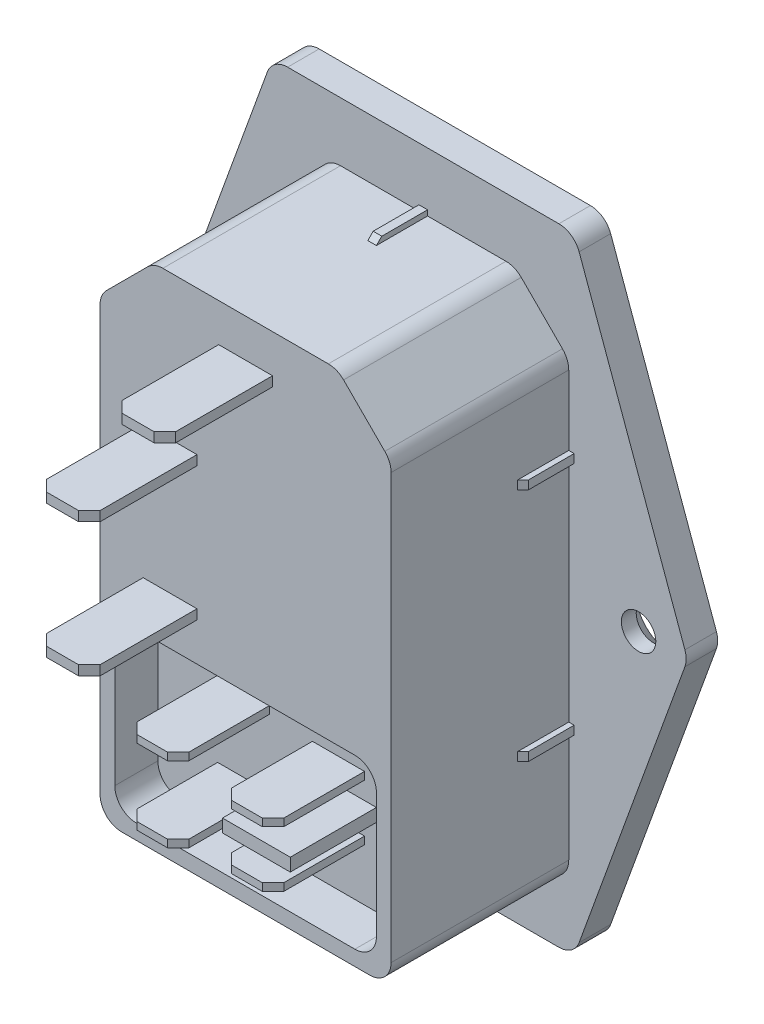
from build123d import *

# Parameters (mm, degrees)
BOSS_EXTRUDE1_START                               = -19.6
BOSS_EXTRUDE1_DEPTH                               = 10
SKETCH2_W                                         = 0.7
SKETCH2_H                                         = 10
BOSS_EXTRUDE2_DEPTH                               = 2
SKETCH3_W                                         = 17
SKETCH3_H                                         = 0.7
BOSS_EXTRUDE3_DEPTH                               = 2
SKETCH4_W                                         = 17
SKETCH4_H                                         = 0.7
BOSS_EXTRUDE4_DEPTH                               = 2
SKETCH5_W                                         = 0.7
SKETCH5_H                                         = 14
BOSS_EXTRUDE5_DEPTH                               = 2
SKETCH6_W                                         = 0.05
SKETCH6_H                                         = 14.2
BOSS_EXTRUDE6_DEPTH                               = 19.1
SKETCH7_W                                         = 0.75
SKETCH7_H                                         = 14.2
BOSS_EXTRUDE7_DEPTH                               = 4.475
SKETCH8_W                                         = 23.575
SKETCH8_H                                         = 0.75
BOSS_EXTRUDE8_DEPTH                               = 34.725
SKETCH9_W                                         = 23.575
SKETCH9_H                                         = 0.75
BOSS_EXTRUDE9_DEPTH                               = 5.525
BOSS_EXTRUDE10_DEPTH                              = 0.1
SKETCH11_W                                        = 0.75
SKETCH11_H                                        = 54.45
BOSS_EXTRUDE11_DEPTH                              = 4.475
BOSS_EXTRUDE12_DEPTH                              = 2.93
BOSS_EXTRUDE13_DEPTH                              = 16.5
CUT_EXTRUDE1_DEPTH                                = 19
BOSS_EXTRUDE14_DEPTH                              = 0.7
SKETCH16_W                                        = 2
SKETCH16_H                                        = 4
BOSS_EXTRUDE15_DEPTH                              = 19
SKETCH17_W                                        = 2
SKETCH17_H                                        = 4
BOSS_EXTRUDE16_DEPTH                              = 19
SKETCH18_W                                        = 2
SKETCH18_H                                        = 4
BOSS_EXTRUDE17_DEPTH                              = 19
SKETCH19_W                                        = 24.3
SKETCH19_H                                        = 15.6
CUT_EXTRUDE2_DEPTH                                = 4
SKETCH20_W                                        = 4.84
SKETCH20_H                                        = 0.7
BOSS_EXTRUDE18_DEPTH                              = 8.5
SKETCH21_W                                        = 4.84
SKETCH21_H                                        = 0.7
BOSS_EXTRUDE19_DEPTH                              = 8.5
SKETCH22_W                                        = 6.3
SKETCH22_H                                        = 1.2
BOSS_EXTRUDE20_DEPTH                              = 8
SKETCH23_W                                        = 4.84
SKETCH23_H                                        = 0.7
BOSS_EXTRUDE21_DEPTH                              = 8.5
SKETCH24_W                                        = 4.84
SKETCH24_H                                        = 0.7
BOSS_EXTRUDE22_DEPTH                              = 8.5
SKETCH25_W                                        = 5
SKETCH25_H                                        = 0.9
BOSS_EXTRUDE23_DEPTH                              = 10
SKETCH26_W                                        = 5
SKETCH26_H                                        = 0.9
BOSS_EXTRUDE24_DEPTH                              = 10
SKETCH27_W                                        = 5
SKETCH27_H                                        = 0.9
BOSS_EXTRUDE25_DEPTH                              = 10
CSK_FOR_4_FLAT_HEAD_MACHINE_SCREW_100_D           = 3.2
CSK_FOR_4_FLAT_HEAD_MACHINE_SCREW_100_DEPTH       = 29.43
CSK_FOR_4_FLAT_HEAD_MACHINE_SCREW_100_CSINK_D     = 6.3
CSK_FOR_4_FLAT_HEAD_MACHINE_SCREW_100_CSINK_ANGLE = 90
RIB1_START                                        = -0.4
RIB1_DEPTH                                        = 0.8
RIB2_START                                        = -0.4
RIB2_DEPTH                                        = 0.8
RIB3_START                                        = -0.4
RIB3_DEPTH                                        = 0.8
RIB4_START                                        = -0.4
RIB4_DEPTH                                        = 0.8
RIB5_START                                        = -0.4
RIB5_DEPTH                                        = 0.8
RIB6_START                                        = -0.4
RIB6_DEPTH                                        = 0.8
CHAMFER1_SIZE                                     = 1
FILLET1_R                                         = 2


with BuildPart() as part:
    # Boss-Extrude1: read off the stored shape, not the designer's step
    # Boss-Extrude1 outline → Boss-Extrude1 (new body)
    with BuildSketch(Plane(origin=(0, 0, 0), x_dir=(1, 0, 0), z_dir=(0, 1, 0)).offset(BOSS_EXTRUDE1_START)):
        with BuildLine():
            Line((7.5, 2.98), (7.5, 3.68))
            add(Edge.make_bspline(
                [(7.5, 3.68), (7.201483498, 6.178633686), (5.307474854, 7.88)],
                knots=[0, 0, 0, 1, 1, 1], degree=2))
            add(Edge.make_bspline(
                [(-7.5, 3.68), (-3.104050378, 4.272071835), (1.728784868, 4.980414582), (5.307474854, 7.88)],
                knots=[0, 0, 0, 0, 1, 1, 1, 1], degree=3))
            Line((-7.5, 3.68), (-7.5, 2.98))
            Line((-7.5, 2.98), (7.5, 2.98))
        make_face()
    extrude(amount=BOSS_EXTRUDE1_DEPTH)

    # Sketch2 → Boss-Extrude2 (add)
    with BuildSketch(Plane(origin=(7.5, 0, 0), x_dir=(0, 0, -1), z_dir=(1, 0, 0))):
        with Locations((3.33, -14.6)):
            Rectangle(SKETCH2_W, SKETCH2_H)
    extrude(amount=BOSS_EXTRUDE2_DEPTH)

    # Sketch3 → Boss-Extrude3 (add)
    with BuildSketch(Plane.XZ.offset(19.6)):
        with Locations((1, -3.33)):
            Rectangle(SKETCH3_W, SKETCH3_H)
    extrude(amount=BOSS_EXTRUDE3_DEPTH)

    # Sketch4 → Boss-Extrude4 (add)
    with BuildSketch(Plane(origin=(0, -9.6, 0), x_dir=(-1, 0, 0), z_dir=(0, 1, 0))):
        with Locations((-1, -3.33)):
            Rectangle(SKETCH4_W, SKETCH4_H)
    extrude(amount=BOSS_EXTRUDE4_DEPTH)

    # Sketch5 → Boss-Extrude5 (add)
    with BuildSketch(Plane.ZY.offset(7.5)):
        with Locations((-3.33, -14.6)):
            Rectangle(SKETCH5_W, SKETCH5_H)
    extrude(amount=BOSS_EXTRUDE5_DEPTH)

    # Sketch6 → Boss-Extrude6 (add)
    with BuildSketch(Plane(origin=(9.5, 0, 0), x_dir=(0, 0, -1), z_dir=(1, 0, 0))):
        with Locations((2.955, -14.6)):
            Rectangle(SKETCH6_W, SKETCH6_H)
    extrude(amount=-BOSS_EXTRUDE6_DEPTH)

    # Sketch7 → Boss-Extrude7 (add)
    with BuildSketch(Plane.ZY.offset(9.6)):
        with Locations((-3.305, -14.6)):
            Rectangle(SKETCH7_W, SKETCH7_H)
    extrude(amount=BOSS_EXTRUDE7_DEPTH)

    # Sketch8 → Boss-Extrude8 (add)
    with BuildSketch(Plane(origin=(0, -7.5, 0), x_dir=(-1, 0, 0), z_dir=(0, 1, 0))):
        with Locations((2.2875, -3.305)):
            Rectangle(SKETCH8_W, SKETCH8_H)
    extrude(amount=BOSS_EXTRUDE8_DEPTH)

    # Sketch9 → Boss-Extrude9 (add)
    with BuildSketch(Plane.XZ.offset(21.7)):
        with Locations((-2.2875, -3.305)):
            Rectangle(SKETCH9_W, SKETCH9_H)
    extrude(amount=BOSS_EXTRUDE9_DEPTH)

    # Sketch10 → Boss-Extrude10 (add)
    with BuildSketch(Plane(origin=(9.5, 0, 0), x_dir=(0, 0, -1), z_dir=(1, 0, 0))):
        Polygon((2.98, -7.5), (2.98, -21.7), (3.68, -21.7), (3.68, -27.225), (2.93, -27.225), (2.93, 27.225), (3.68, 27.225), (3.68, -7.5), align=None)
    extrude(amount=BOSS_EXTRUDE10_DEPTH)

    # Sketch11 → Boss-Extrude11 (add)
    with BuildSketch(Plane(origin=(9.6, 0, 0), x_dir=(0, 0, -1), z_dir=(1, 0, 0))):
        with Locations((3.305, 0)):
            Rectangle(SKETCH11_W, SKETCH11_H)
    extrude(amount=BOSS_EXTRUDE11_DEPTH)

    # Sketch12 → Boss-Extrude12 (add)
    with BuildSketch(Plane(origin=(0, 0, -2.93), x_dir=(-1, 0, 0), z_dir=(0, 0, -1))):
        Polygon((-14, -29.1), (14, -29.1), (24.55, 0), (14, 29.1), (-14, 29.1), (-24.55, 0), align=None)
    extrude(amount=-BOSS_EXTRUDE12_DEPTH)

    # Sketch13 → Boss-Extrude13 (add)
    with BuildSketch(Plane.XY):
        Polygon((13.515, -23.625), (-13.515, -23.625), (-13.515, 18.625), (-8.515, 23.625), (8.515, 23.625), (13.515, 18.625), align=None)
    extrude(amount=BOSS_EXTRUDE13_DEPTH)

    # Sketch14 → Cut-Extrude1 (cut)
    with BuildSketch(Plane(origin=(0, 0, -3.68), x_dir=(-1, 0, 0), z_dir=(0, 0, -1))):
        Polygon((-7.3, 22.625), (-12.3, 17.625), (-12.3, 5.905), (12.3, 5.905), (12.3, 17.625), (7.3, 22.625), align=None)
    extrude(amount=-CUT_EXTRUDE1_DEPTH, mode=Mode.SUBTRACT)

    # Sketch15 → Boss-Extrude14 (add)
    with BuildSketch(Plane(origin=(0, 0, -3.68), x_dir=(-1, 0, 0), z_dir=(0, 0, -1))):
        Polygon((-12.41, -4.895), (-12.41, 3.805), (-4.45, 3.805), (-4.45, 5.905), (4.45, 5.905), (4.45, 3.805), (12.41, 3.805), (12.41, -4.895), align=None)
    extrude(amount=BOSS_EXTRUDE14_DEPTH)

    # Sketch16 → Boss-Extrude15 (add)
    with BuildSketch(Plane(origin=(0, 0, 15.32), x_dir=(-1, 0, 0), z_dir=(0, 0, -1))):
        with Locations((-6.886124402, 10.905)):
            Rectangle(SKETCH16_W, SKETCH16_H)
    extrude(amount=BOSS_EXTRUDE15_DEPTH)

    # Sketch17 → Boss-Extrude16 (add)
    with BuildSketch(Plane(origin=(0, 0, 15.32), x_dir=(-1, 0, 0), z_dir=(0, 0, -1))):
        with Locations((6.886124402, 10.905)):
            Rectangle(SKETCH17_W, SKETCH17_H)
    extrude(amount=BOSS_EXTRUDE16_DEPTH)

    # Sketch18 → Boss-Extrude17 (add)
    with BuildSketch(Plane(origin=(0, 0, 15.32), x_dir=(-1, 0, 0), z_dir=(0, 0, -1))):
        with Locations((0, 17.625)):
            Rectangle(SKETCH18_W, SKETCH18_H)
    extrude(amount=BOSS_EXTRUDE17_DEPTH)

    # Sketch19 → Cut-Extrude2 (cut)
    with BuildSketch(Plane.XY.offset(16.5)):
        with Locations((0, -14.425)):
            Rectangle(SKETCH19_W, SKETCH19_H)
    extrude(amount=-CUT_EXTRUDE2_DEPTH, mode=Mode.SUBTRACT)

    # Sketch20 → Boss-Extrude18 (add)
    with BuildSketch(Plane.XY.offset(12.5)):
        with Locations((-4.18, -10.925)):
            Rectangle(SKETCH20_W, SKETCH20_H)
    extrude(amount=BOSS_EXTRUDE18_DEPTH)

    # Sketch21 → Boss-Extrude19 (add)
    with BuildSketch(Plane.XY.offset(12.5)):
        with Locations((4.63, -11.825)):
            Rectangle(SKETCH21_W, SKETCH21_H)
    extrude(amount=BOSS_EXTRUDE19_DEPTH)

    # Sketch22 → Boss-Extrude20 (add)
    with BuildSketch(Plane.XY.offset(12.5)):
        with Locations((5, -14.425)):
            Rectangle(SKETCH22_W, SKETCH22_H)
    extrude(amount=BOSS_EXTRUDE20_DEPTH)

    # Sketch23 → Boss-Extrude21 (add)
    with BuildSketch(Plane.XY.offset(12.5)):
        with Locations((4.63, -17.025)):
            Rectangle(SKETCH23_W, SKETCH23_H)
    extrude(amount=BOSS_EXTRUDE21_DEPTH)

    # Sketch24 → Boss-Extrude22 (add)
    with BuildSketch(Plane.XY.offset(12.5)):
        with Locations((-4.18, -17.925)):
            Rectangle(SKETCH24_W, SKETCH24_H)
    extrude(amount=BOSS_EXTRUDE22_DEPTH)

    # Sketch25 → Boss-Extrude23 (add)
    with BuildSketch(Plane.XY.offset(16.5)):
        with Locations((-7.015, 9.775)):
            Rectangle(SKETCH25_W, SKETCH25_H)
    extrude(amount=BOSS_EXTRUDE23_DEPTH)

    # Sketch26 → Boss-Extrude24 (add)
    with BuildSketch(Plane.XY.offset(16.5)):
        with Locations((0, 19.625)):
            Rectangle(SKETCH26_W, SKETCH26_H)
    extrude(amount=BOSS_EXTRUDE24_DEPTH)

    # Sketch27 → Boss-Extrude25 (add)
    with BuildSketch(Plane.XY.offset(16.5)):
        with Locations((-7.015, -2.625)):
            Rectangle(SKETCH27_W, SKETCH27_H)
    extrude(amount=BOSS_EXTRUDE25_DEPTH)

    # CSK for #4 Flat Head Machine Screw (100)1
    with Locations(Plane(origin=(0, 0, -2.93), x_dir=(-1, 0, 0), z_dir=(0, 0, -1))):
        with Locations((20, 0), (-20, 0)):
            CounterSinkHole(CSK_FOR_4_FLAT_HEAD_MACHINE_SCREW_100_D / 2, CSK_FOR_4_FLAT_HEAD_MACHINE_SCREW_100_CSINK_D / 2, depth=CSK_FOR_4_FLAT_HEAD_MACHINE_SCREW_100_DEPTH, counter_sink_angle=CSK_FOR_4_FLAT_HEAD_MACHINE_SCREW_100_CSINK_ANGLE)

    # Rib1: read off the stored shape, not the designer's step
    # Rib1 outline → Rib1 (add)
    with BuildSketch(Plane.XZ.offset(10.925).offset(RIB1_START)):
        Polygon((13.515, 0), (14.015, 0), (14.015, 4.25), (13.515, 4.75), align=None)
    extrude(amount=RIB1_DEPTH)

    # Rib2: read off the stored shape, not the designer's step
    # Rib2 outline → Rib2 (add)
    with BuildSketch(Plane.XZ.offset(-10.925).offset(RIB2_START)):
        Polygon((13.515, 0), (14.015, 0), (14.015, 4.25), (13.515, 4.75), align=None)
    extrude(amount=RIB2_DEPTH)

    # Rib3: read off the stored shape, not the designer's step
    # Rib3 outline → Rib3 (add)
    with BuildSketch(Plane(origin=(0, 0, 0), x_dir=(0, 0, -1), z_dir=(1, 0, 0)).offset(RIB3_START)):
        Polygon((0, 23.625), (0, 24.125), (-4.25, 24.125), (-4.75, 23.625), align=None)
    extrude(amount=RIB3_DEPTH)

    # Rib4: read off the stored shape, not the designer's step
    # Rib4 outline → Rib4 (add)
    with BuildSketch(Plane(origin=(0, 0, 0), x_dir=(0, -1, 0), z_dir=(-1, 0, 0)).offset(RIB4_START)):
        Polygon((23.625, 0), (24.125, 0), (24.125, 4.25), (23.625, 4.75), align=None)
    extrude(amount=RIB4_DEPTH)

    # Rib5: read off the stored shape, not the designer's step
    # Rib5 outline → Rib5 (add)
    with BuildSketch(Plane(origin=(0, 10.925, 0), x_dir=(1, 0, 0), z_dir=(0, 1, 0)).offset(RIB5_START)):
        Polygon((-13.515, 0), (-14.015, 0), (-14.015, -4.25), (-13.515, -4.75), align=None)
    extrude(amount=RIB5_DEPTH)

    # Rib6: read off the stored shape, not the designer's step
    # Rib6 outline → Rib6 (add)
    with BuildSketch(Plane(origin=(0, -10.925, 0), x_dir=(1, 0, 0), z_dir=(0, 1, 0)).offset(RIB6_START)):
        Polygon((-13.515, 0), (-14.015, 0), (-14.015, -4.25), (-13.515, -4.75), align=None)
    extrude(amount=RIB6_DEPTH)

    # Chamfer1
    chamfer1_edges = [part.edges().sort_by_distance(p)[0] for p in [
        (7.05, -17.025, 21),
        (2.21, -17.025, 21),
        (-1.76, -17.925, 21),
        (-6.6, -17.925, 21),
        (-4.515, 9.775, 26.5),
        (-9.515, 9.775, 26.5),
        (-2.5, 19.625, 26.5),
        (2.5, 19.625, 26.5),
        (-9.515, -2.625, 26.5),
        (-4.515, -2.625, 26.5),
        (6.886124402, 8.905, -3.68),
        (6.886124402, 12.905, -3.68),
        (-6.886124402, 8.905, -3.68),
        (-6.886124402, 12.905, -3.68),
        (0, 15.625, -3.68),
        (0, 19.625, -3.68),
        (-6.6, -10.925, 21),
        (-1.76, -10.925, 21),
        (2.21, -11.825, 21),
        (7.05, -11.825, 21),
    ]]
    chamfer(chamfer1_edges, length=CHAMFER1_SIZE)

    # Fillet1
    fillet1_edges = [part.edges().sort_by_distance(p)[0] for p in [
        (-14.075, 27.225, -3.305),
        (-14.075, -27.225, -3.305),
        (14.075, -27.225, -3.305),
        (14.075, 27.225, -3.305),
        (14, -29.1, -1.465),
        (24.55, 0, -1.465),
        (14, 29.1, -1.465),
        (-14, 29.1, -1.465),
        (-24.55, 0, -1.465),
        (-14, -29.1, -1.465),
        (13.515, -23.625, 8.25),
        (13.515, 18.625, 8.25),
        (8.515, 23.625, 8.25),
        (-8.515, 23.625, 8.25),
        (-13.515, 18.625, 8.25),
        (-13.515, -23.625, 8.25),
        (-12.3, 5.905, 5.82),
        (12.3, 5.905, 5.82),
        (12.15, -6.625, 14.5),
        (12.15, -22.225, 14.5),
        (-12.15, -22.225, 14.5),
        (-12.15, -6.625, 14.5),
    ]]
    fillet(fillet1_edges, radius=FILLET1_R)


solid = part.part
